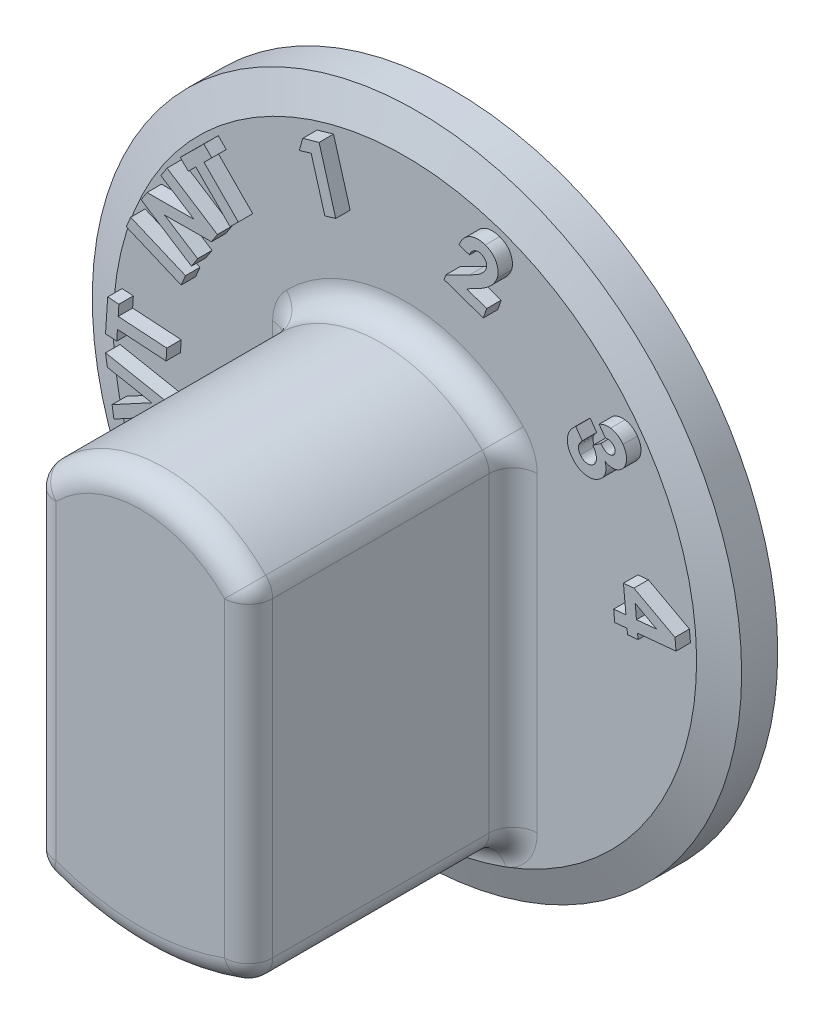
from build123d import *

# Parameters (mm, degrees)
SKETCH1_R           = 13.5
BOSS_EXTRUDE1_DEPTH = 2
CHAMFER1_SIZE       = 0.5
CHAMFER1_SIZE2      = 1.37373871
BOSS_EXTRUDE2_DEPTH = 11
FILLET1_R           = 1
HUECO_DEPTH         = 9.5
TEXTOS_DEPTH        = 0.6
SKETCH8_R           = 3.5
CUT_EXTRUDE1_DEPTH  = 0.6


with BuildPart() as part:
    # Sketch1 → Boss-Extrude1 (new body)
    with BuildSketch(Plane.XY):
        Circle(SKETCH1_R)
    extrude(amount=BOSS_EXTRUDE1_DEPTH)

    # Chamfer1
    chamfer1_edges = [part.edges().sort_by_distance(p)[0] for p in [
        (-13.5, 0, 2),
    ]]
    chamfer1_side = [part.faces().sort_by_distance(p)[0] for p in [
        (-13.5, 0, 1),
    ]]
    chamfer(chamfer1_edges, length=CHAMFER1_SIZE, length2=CHAMFER1_SIZE2, reference=chamfer1_side[0])

    # Sketch2 → Boss-Extrude2 (add)
    with BuildSketch(Plane.XY.offset(2)):
        with BuildLine():
            Line((-4.5, 3.437234545), (-4.5, -9.502166475))
            ThreePointArc((-4.5, -9.502166475), (-4.320254825, -10.074164746), (-3.845635956, -10.440535158))
            ThreePointArc((-3.845635956, -10.440535158), (0, -11.12626129), (3.845635956, -10.440535158))
            ThreePointArc((3.845635956, -10.440535158), (4.320254825, -10.074164746), (4.5, -9.502166475))
            Line((4.5, -9.502166475), (4.5, 3.437234545))
            ThreePointArc((4.5, 3.437234545), (4.425601213, 3.815734736), (4.213475212, 4.137915016))
            ThreePointArc((4.213475212, 4.137915016), (0, 5.905566361), (-4.213475212, 4.137915016))
            ThreePointArc((-4.213475212, 4.137915016), (-4.425601213, 3.815734736), (-4.5, 3.437234545))
        make_face()
    extrude(amount=BOSS_EXTRUDE2_DEPTH)

    # Fillet1
    fillet1_edges = [part.edges().sort_by_distance(p)[0] for p in [
        (4.425601213, 3.815734736, 2),
        (0, 5.905566361, 2),
        (-4.425601213, 3.815734736, 2),
        (-4.5, -3.032465965, 2),
        (-4.320254825, -10.074164746, 2),
        (0, -11.12626129, 2),
        (4.320254825, -10.074164746, 2),
        (4.5, -3.032465965, 2),
        (4.425601213, 3.815734736, 13),
        (0, 5.905566361, 13),
        (-4.425601213, 3.815734736, 13),
        (-4.5, -3.032465965, 13),
        (-4.320254825, -10.074164746, 13),
        (0, -11.12626129, 13),
        (4.320254825, -10.074164746, 13),
        (4.5, -3.032465965, 13),
    ]]
    fillet(fillet1_edges, radius=FILLET1_R - 0.0001)  # a hair under: the kernel refuses the full size

    # Sketch6 → Hueco (cut)
    with BuildSketch(Plane(origin=(0, 0, 0), x_dir=(-1, 0, 0), z_dir=(0, 0, -1))):
        with BuildLine():
            ThreePointArc((-1.941278917, 1.947802907), (-2.106622219, 1.767665927), (-2.255310951, 1.573554103))
            ThreePointArc((-2.255310951, 1.573554103), (-2.663028117, 1.5375), (-2.490393303, 1.166379525))
            ThreePointArc((-2.490393303, 1.166379525), (-2.584154707, 0.940555394), (-2.657486258, 0.707295405))
            ThreePointArc((-2.657486258, 0.707295405), (-3.028283841, 0.533968146), (-2.739129502, 0.244273558))
            ThreePointArc((-2.739129502, 0.244273558), (-2.75, 0), (-2.739129502, -0.244273558))
            ThreePointArc((-2.739129502, -0.244273558), (-3.028283841, -0.533968146), (-2.657486258, -0.707295405))
            ThreePointArc((-2.657486258, -0.707295405), (-2.584154707, -0.940555394), (-2.490393303, -1.166379525))
            ThreePointArc((-2.490393303, -1.166379525), (-2.663028117, -1.5375), (-2.255310951, -1.573554103))
            ThreePointArc((-2.255310951, -1.573554103), (-2.106622219, -1.767665927), (-1.941278917, -1.947802907))
            ThreePointArc((-1.941278917, -1.947802907), (-1.9765719, -2.355586663), (-1.581111858, -2.250018954))
            ThreePointArc((-1.581111858, -2.250018954), (-1.375, -2.38156986), (-1.158017644, -2.494292512))
            ThreePointArc((-1.158017644, -2.494292512), (-1.051711941, -2.889554809), (-0.71620734, -2.655098312))
            ThreePointArc((-0.71620734, -2.655098312), (-0.477532489, -2.708221321), (-0.235082352, -2.739933628))
            ThreePointArc((-0.235082352, -2.739933628), (0, -3.075), (0.235082352, -2.739933628))
            ThreePointArc((0.235082352, -2.739933628), (0.477532489, -2.708221321), (0.71620734, -2.655098312))
            ThreePointArc((0.71620734, -2.655098312), (1.051711941, -2.889554809), (1.158017644, -2.494292512))
            ThreePointArc((1.158017644, -2.494292512), (1.375, -2.38156986), (1.581111858, -2.250018954))
            ThreePointArc((1.581111858, -2.250018954), (1.9765719, -2.355586663), (1.941278917, -1.947802907))
            ThreePointArc((1.941278917, -1.947802907), (2.106622219, -1.767665927), (2.255310951, -1.573554103))
            ThreePointArc((2.255310951, -1.573554103), (2.663028117, -1.5375), (2.490393303, -1.166379525))
            ThreePointArc((2.490393303, -1.166379525), (2.584154707, -0.940555394), (2.657486258, -0.707295405))
            ThreePointArc((2.657486258, -0.707295405), (3.028283841, -0.533968146), (2.739129502, -0.244273558))
            ThreePointArc((2.739129502, -0.244273558), (2.75, 0), (2.739129502, 0.244273558))
            ThreePointArc((2.739129502, 0.244273558), (3.028283841, 0.533968146), (2.657486258, 0.707295405))
            ThreePointArc((2.657486258, 0.707295405), (2.584154707, 0.940555394), (2.490393303, 1.166379525))
            ThreePointArc((2.490393303, 1.166379525), (2.663028117, 1.5375), (2.255310951, 1.573554103))
            ThreePointArc((2.255310951, 1.573554103), (2.106622219, 1.767665927), (1.941278917, 1.947802907))
            ThreePointArc((1.941278917, 1.947802907), (1.9765719, 2.355586663), (1.581111858, 2.250018954))
            ThreePointArc((1.581111858, 2.250018954), (1.375, 2.38156986), (1.158017644, 2.494292512))
            ThreePointArc((1.158017644, 2.494292512), (1.051711941, 2.889554809), (0.71620734, 2.655098312))
            ThreePointArc((0.71620734, 2.655098312), (0.477532489, 2.708221321), (0.235082352, 2.739933628))
            ThreePointArc((0.235082352, 2.739933628), (0, 3.075), (-0.235082352, 2.739933628))
            ThreePointArc((-0.235082352, 2.739933628), (-0.477532489, 2.708221321), (-0.71620734, 2.655098312))
            ThreePointArc((-0.71620734, 2.655098312), (-1.051711941, 2.889554809), (-1.158017644, 2.494292512))
            ThreePointArc((-1.158017644, 2.494292512), (-1.375, 2.38156986), (-1.581111858, 2.250018954))
            ThreePointArc((-1.581111858, 2.250018954), (-1.9765719, 2.355586663), (-1.941278917, 1.947802907))
        make_face()
    extrude(amount=-HUECO_DEPTH, mode=Mode.SUBTRACT)

    # Sketch7 → Textos (add, symmetric)
    # profile 1 of 10: a face of its own
    with BuildSketch(Plane.XY.offset(2)):
        Polygon((11.826804085, 1.007222563), (11.872377001, 0.533965351), (10.271315303, 0.379718556), (10.292849758, 0.15836439), (9.855149437, 0.116297082), (9.833614982, 0.337651249), (9.323298476, 0.288572723), (9.278727162, 0.751313108), (9.789043668, 0.800391633), (9.684877001, 1.885628011), (10.122577322, 1.927695319), align=None)
        Polygon((10.226743989, 0.842458941), (11.060077322, 0.922587146), (10.172156649, 1.410367595), align=None, mode=Mode.SUBTRACT)
    # profile 2 of 10: a face of its own
    with BuildSketch(Plane.XY.offset(2)):
        with BuildLine():
            Line((8.935891774, 6.73477376), (8.672470299, 7.105366709))
            add(Edge.make_bspline(
                [(8.672470299, 7.105366709), (8.692680934, 7.115721089), (8.732297847, 7.136017759), (8.793357979, 7.160196491), (8.853492449, 7.180783426), (8.913526058, 7.195217605), (8.97301642, 7.204311224), (9.031971126, 7.208306677), (9.090491851, 7.207613867), (9.129061928, 7.202874467), (9.148231517, 7.200518952)],
                knots=[0, 0, 0, 0, 1.103396783, 2.162879835, 3.189462023, 4.191399139, 5.160146845, 6.111917816, 7.06161038, 8, 8, 8, 8], degree=3))
            add(Edge.make_bspline(
                [(9.148231517, 7.200518952), (9.174396224, 7.19570593), (9.22618194, 7.186179898), (9.300995459, 7.16278587), (9.372244831, 7.132648926), (9.439671569, 7.094972857), (9.502800201, 7.049544382), (9.562398814, 6.997491442), (9.618428578, 6.938349529), (9.651311996, 6.894056149), (9.668063248, 6.87149251)],
                knots=[0, 0, 0, 0, 1.008156502, 1.995363734, 2.965452835, 3.93760543, 4.917866365, 5.909448424, 6.935045135, 8, 8, 8, 8], degree=3))
            add(Edge.make_bspline(
                [(9.668063248, 6.87149251), (9.682165351, 6.850883554), (9.709939929, 6.810293503), (9.743808291, 6.746000365), (9.770893855, 6.680860544), (9.792673394, 6.61509693), (9.805570496, 6.547733413), (9.813597694, 6.479593711), (9.813942845, 6.410427641), (9.807338563, 6.34121289), (9.794741325, 6.273612647), (9.777708657, 6.208803224), (9.75386284, 6.148047709), (9.724148445, 6.091524492), (9.689577966, 6.038278025), (9.648599069, 5.9896914), (9.602472585, 5.944608738), (9.56787574, 5.918602219), (9.550374947, 5.905446837)],
                knots=[0, 0, 0, 0, 1.10669362, 2.179671362, 3.214931463, 4.233326567, 5.245243608, 6.250777107, 7.272395839, 8.305881078, 9.329536189, 10.319027588, 11.273075315, 12.216755946, 13.146866148, 14.08238128, 15.029973707, 16, 16, 16, 16], degree=3))
            add(Edge.make_bspline(
                [(9.550374947, 5.905446837), (9.527760118, 5.890504619), (9.483012973, 5.860938991), (9.408837539, 5.830012925), (9.33137591, 5.810352207), (9.250922094, 5.801713941), (9.168390339, 5.805350114), (9.08491869, 5.821407813), (9.000702842, 5.848799558), (8.946921297, 5.875990313), (8.919365331, 5.889921997)],
                knots=[0, 0, 0, 0, 0.973368935, 1.925969927, 2.874206825, 3.840509872, 4.826323472, 5.834583233, 6.890508817, 8, 8, 8, 8], degree=3))
            add(Edge.make_bspline(
                [(8.919365331, 5.889921997), (8.925334348, 5.871475244), (8.937103458, 5.835103778), (8.949434441, 5.779955914), (8.957685673, 5.725567603), (8.961019996, 5.671959901), (8.96072765, 5.619040474), (8.955679972, 5.566750795), (8.946057883, 5.515207417), (8.932592636, 5.464609058), (8.915098754, 5.415487213), (8.893483262, 5.368237505), (8.86795724, 5.323193859), (8.838486573, 5.28028335), (8.805838279, 5.239107841), (8.768029022, 5.201206662), (8.727824949, 5.164155775), (8.698066043, 5.142288341), (8.682987126, 5.131208055)],
                knots=[0, 0, 0, 0, 1.086078135, 2.14142045, 3.16283628, 4.166008758, 5.148375047, 6.125828803, 7.105697244, 8.083777602, 9.057328436, 10.02438465, 10.99216464, 11.954866766, 12.939635693, 13.932018698, 14.95214838, 16, 16, 16, 16], degree=3))
            add(Edge.make_bspline(
                [(8.682987126, 5.131208055), (8.660253424, 5.115851999), (8.615601575, 5.085690775), (8.544091682, 5.049480755), (8.470901996, 5.02135569), (8.395717125, 5.001150415), (8.318837995, 4.9889677), (8.23991286, 4.98567568), (8.159242288, 4.990271739), (8.077412459, 5.002812588), (7.996484458, 5.022992553), (7.918245016, 5.051425948), (7.843275505, 5.086765587), (7.772340792, 5.13102762), (7.70450837, 5.182187474), (7.64029815, 5.241032294), (7.579649319, 5.307626874), (7.543252083, 5.356571825), (7.524633761, 5.381608696)],
                knots=[0, 0, 0, 0, 0.994162639, 1.952660351, 2.899364803, 3.833381905, 4.771002391, 5.716408938, 6.692657941, 7.697017763, 8.714592818, 9.712362041, 10.711617939, 11.714681377, 12.739059548, 13.788953909, 14.868980899, 16, 16, 16, 16], degree=3))
            add(Edge.make_bspline(
                [(7.524633761, 5.381608696), (7.507958194, 5.406017379), (7.475345544, 5.453753799), (7.435487376, 5.529066345), (7.402457044, 5.604240514), (7.377831282, 5.680236291), (7.360911187, 5.7566884), (7.353180488, 5.833968635), (7.352487841, 5.911631846), (7.360088916, 5.98950715), (7.375600987, 6.066333331), (7.398647103, 6.141438817), (7.429871226, 6.213992136), (7.469514509, 6.283663493), (7.515546647, 6.351767201), (7.570115281, 6.416940777), (7.632283829, 6.479774545), (7.678383182, 6.518294163), (7.701917415, 6.537958856)],
                knots=[0, 0, 0, 0, 1.084912083, 2.121778519, 3.124063135, 4.09736983, 5.050993605, 5.994153796, 6.944480523, 7.899227032, 8.862342566, 9.818407093, 10.779627863, 11.756846648, 12.758455971, 13.794651513, 14.87414508, 16, 16, 16, 16], degree=3))
            Line((7.701917415, 6.537958856), (7.97335171, 6.156348279))
            add(Edge.make_bspline(
                [(7.97335171, 6.156348279), (7.951938705, 6.134250159), (7.911260432, 6.092270373), (7.86400429, 6.022685799), (7.831201189, 5.952838536), (7.814629109, 5.882127633), (7.814019141, 5.81209704), (7.826077495, 5.743155968), (7.852786091, 5.675479544), (7.879453576, 5.633931624), (7.893223505, 5.612478087)],
                knots=[0, 0, 0, 0, 1.21344472, 2.305180295, 3.305378785, 4.245813004, 5.149184569, 6.053229573, 6.994772523, 8, 8, 8, 8], degree=3))
            add(Edge.make_bspline(
                [(7.893223505, 5.612478087), (7.901175985, 5.60160554), (7.916807573, 5.580234196), (7.943805777, 5.551880344), (7.971511647, 5.525811608), (8.002210967, 5.504590583), (8.033377527, 5.48509644), (8.067057074, 5.470183898), (8.102023691, 5.458052117), (8.150318662, 5.446874026), (8.21133014, 5.441925407), (8.283335075, 5.449600608), (8.352201929, 5.473182205), (8.393147413, 5.499088429), (8.414056838, 5.512317831)],
                knots=[0, 0, 0, 0, 0.818353892, 1.608576324, 2.377577747, 3.127028539, 3.873999524, 4.610058134, 5.36136341, 6.122347517, 7.619769825, 9.060498181, 10.498899403, 12, 12, 12, 12], degree=3))
            add(Edge.make_bspline(
                [(8.414056838, 5.512317831), (8.425101478, 5.520763801), (8.446841741, 5.537388844), (8.475746722, 5.566094951), (8.499726698, 5.598136419), (8.520637525, 5.632331313), (8.537164364, 5.669733065), (8.549616486, 5.709914897), (8.558088493, 5.752722145), (8.562559822, 5.797987884), (8.562771616, 5.845348343), (8.556848424, 5.894295333), (8.546470211, 5.94450658), (8.530005011, 5.995791708), (8.508846301, 6.048469686), (8.482781641, 6.102617816), (8.451165284, 6.157860971), (8.426660259, 6.193901608), (8.414056838, 6.212438023)],
                knots=[0, 0, 0, 0, 0.853699976, 1.680422637, 2.492706139, 3.307058826, 4.13803267, 4.997626229, 5.886634055, 6.814260636, 7.788562636, 8.789752487, 9.837703632, 10.934068485, 12.093882313, 13.323211373, 14.62327442, 16, 16, 16, 16], degree=3))
            Line((8.414056838, 6.212438023), (8.744585684, 6.447313824))
            add(Edge.make_bspline(
                [(8.744585684, 6.447313824), (8.761979254, 6.427002478), (8.794505662, 6.389019755), (8.844480074, 6.339935703), (8.889576212, 6.300086666), (8.932688767, 6.270868428), (8.974662061, 6.251024023), (9.015684519, 6.236463248), (9.057451641, 6.229155668), (9.098893261, 6.226856489), (9.13931187, 6.231091109), (9.177703221, 6.239846331), (9.213627645, 6.254567242), (9.235068704, 6.2685057), (9.245887767, 6.275538984)],
                knots=[0, 0, 0, 0, 1.634258419, 3.056103969, 4.279447457, 5.309893621, 6.227497039, 7.111915362, 7.962772713, 8.810932038, 9.641716835, 10.438904402, 11.212278056, 12, 12, 12, 12], degree=3))
            add(Edge.make_bspline(
                [(9.245887767, 6.275538984), (9.258756333, 6.285520651), (9.283807575, 6.304951965), (9.312209169, 6.342713622), (9.332254022, 6.384603416), (9.343017527, 6.430483804), (9.34544575, 6.478735581), (9.336274242, 6.527335784), (9.31804882, 6.575829677), (9.298605605, 6.605238896), (9.288455876, 6.620591068)],
                knots=[0, 0, 0, 0, 0.999617133, 1.94595494, 2.879914432, 3.842875369, 4.831156737, 5.833943911, 6.869277492, 8, 8, 8, 8], degree=3))
            add(Edge.make_bspline(
                [(9.288455876, 6.620591068), (9.278369168, 6.633672396), (9.258285685, 6.659718419), (9.220597468, 6.691658628), (9.178477679, 6.717750422), (9.131984073, 6.736402986), (9.083278878, 6.74852689), (9.033706738, 6.752765569), (8.984094066, 6.748125399), (8.952146045, 6.73927606), (8.935891774, 6.73477376)],
                knots=[0, 0, 0, 0, 0.997178702, 1.985466464, 2.969511962, 3.98433942, 5.003531315, 5.996762607, 6.980808105, 8, 8, 8, 8], degree=3))
        make_face()
    # profile 3 of 10: a face of its own
    with BuildSketch(Plane.XY.offset(2)):
        with BuildLine():
            Line((3.283888631, 10.504603799), (2.848191516, 10.656346587))
            add(Edge.make_bspline(
                [(2.848191516, 10.656346587), (2.861126652, 10.68642262), (2.886398951, 10.745184312), (2.930610109, 10.828279382), (2.979631533, 10.904077345), (3.033364928, 10.972548869), (3.091639779, 11.033769337), (3.155150292, 11.086816066), (3.222684551, 11.133472889), (3.294577219, 11.172371396), (3.369694369, 11.203267737), (3.446608135, 11.22673146), (3.525279048, 11.240951062), (3.605238615, 11.248297817), (3.686854587, 11.246708412), (3.769706618, 11.236123671), (3.854396601, 11.219088766), (3.910045577, 11.20095462), (3.938435907, 11.191703158)],
                knots=[0, 0, 0, 0, 1.156015498, 2.258589949, 3.319973446, 4.340274833, 5.328591897, 6.299430632, 7.25779956, 8.223396109, 9.180385618, 10.12238191, 11.057934721, 11.999044881, 12.954380097, 13.934360659, 14.946176778, 16, 16, 16, 16], degree=3))
            add(Edge.make_bspline(
                [(3.938435907, 11.191703158), (3.972838008, 11.178469675), (4.039834013, 11.152698269), (4.132456363, 11.101645477), (4.214332002, 11.041034112), (4.285933216, 10.97175104), (4.346198429, 10.893985635), (4.396232713, 10.809373171), (4.43248206, 10.716501875), (4.457586668, 10.618955293), (4.471437745, 10.519732), (4.471616621, 10.422355258), (4.461199297, 10.327980347), (4.442855332, 10.268348082), (4.433728375, 10.238678318)],
                knots=[0, 0, 0, 0, 1.108947221, 2.159607475, 3.172980879, 4.168291471, 5.14964376, 6.127281529, 7.117629597, 8.140507734, 9.154940234, 10.125080252, 11.067142168, 12, 12, 12, 12], degree=3))
            add(Edge.make_bspline(
                [(4.433728375, 10.238678318), (4.427072539, 10.221241043), (4.413596981, 10.185937137), (4.389589794, 10.13369474), (4.360851215, 10.08215258), (4.328074614, 10.030935011), (4.291590182, 9.97985033), (4.250742011, 9.929221791), (4.206237679, 9.878654369), (4.157286999, 9.82816068), (4.102754064, 9.77748316), (4.040795234, 9.727207575), (3.972257437, 9.675582992), (3.896475916, 9.623600457), (3.813741012, 9.571078068), (3.723920408, 9.517907985), (3.626695326, 9.464497776), (3.559069793, 9.429409291), (3.524273247, 9.4113546)],
                knots=[0, 0, 0, 0, 0.711212675, 1.439937426, 2.188877176, 2.958368846, 3.756367895, 4.580049792, 5.436495162, 6.322830741, 7.25924049, 8.271785174, 9.362240093, 10.528716824, 11.772980213, 13.096483964, 14.506003179, 16, 16, 16, 16], degree=3))
            Line((3.524273247, 9.4113546), (3.164697926, 9.225557324))
            Line((3.164697926, 9.225557324), (4.001036067, 8.934090978))
            Line((4.001036067, 8.934090978), (3.856805298, 8.520429119))
            Line((3.856805298, 8.520429119), (2.230202734, 9.086835369))
            Line((2.230202734, 9.086835369), (2.304822125, 9.300677517))
            Line((2.304822125, 9.300677517), (3.289397445, 9.788457965))
            add(Edge.make_bspline(
                [(3.289397445, 9.788457965), (3.317986023, 9.802728109), (3.373231385, 9.830304133), (3.452458271, 9.871594125), (3.524652582, 9.91250009), (3.590675965, 9.951183081), (3.64986981, 9.988679939), (3.702322911, 10.024939948), (3.748347531, 10.059591873), (3.799541298, 10.103650386), (3.853443524, 10.157926696), (3.90718247, 10.223849255), (3.949671756, 10.289552393), (3.968460114, 10.335679298), (3.977498407, 10.357869023)],
                knots=[0, 0, 0, 0, 1.258257201, 2.431491209, 3.517584003, 4.525483697, 5.444602701, 6.276116506, 7.036053709, 7.711994395, 8.934507047, 10.042267108, 11.058216548, 12, 12, 12, 12], degree=3))
            add(Edge.make_bspline(
                [(3.977498407, 10.357869023), (3.98404471, 10.380052722), (3.996711223, 10.422976201), (4.000977718, 10.489447323), (3.990492887, 10.553710971), (3.967323356, 10.614738371), (3.932808319, 10.670696897), (3.886915055, 10.718669955), (3.829854504, 10.757059765), (3.78658604, 10.774176531), (3.764157061, 10.783049312)],
                knots=[0, 0, 0, 0, 1.039019912, 2.010410838, 2.969247526, 3.949177999, 4.93146899, 5.909553148, 6.91637964, 8, 8, 8, 8], degree=3))
            add(Edge.make_bspline(
                [(3.764157061, 10.783049312), (3.740657516, 10.790040256), (3.694657485, 10.803724931), (3.622713956, 10.804446651), (3.552535635, 10.790794148), (3.496884691, 10.766300325), (3.454606936, 10.739840139), (3.424168967, 10.716436688), (3.395660405, 10.689408157), (3.369360702, 10.658906188), (3.344782714, 10.625218829), (3.321979358, 10.588321784), (3.301610599, 10.547842856), (3.289875224, 10.519210226), (3.283888631, 10.504603799)],
                knots=[0, 0, 0, 0, 1.419430687, 2.778515855, 4.133748901, 5.550888227, 6.283382005, 7.030770308, 7.779103277, 8.563391224, 9.36900811, 10.201309774, 11.082430171, 12, 12, 12, 12], degree=3))
        make_face()
    # profile 4 of 10: a face of its own
    with BuildSketch(Plane.XY.offset(2)):
        Polygon((-3.650720467, 11.234584498), (-2.968629121, 11.431399402), (-2.277523351, 9.037068472), (-2.729746909, 8.906359338), (-3.297154762, 10.872505171), (-3.790444025, 10.730277607), align=None)
    # profile 5 of 10: a face of its own
    with BuildSketch(Plane.XY.offset(2)):
        Polygon((-8.738935277, 8.006295801), (-7.758867168, 8.976848686), (-7.429339925, 8.643815833), (-7.752356752, 8.323803814), (-6.327076303, 6.884000128), (-6.66962438, 6.54495766), (-8.094904829, 7.984761346), (-8.409408034, 7.673262949), align=None)
    # profile 6 of 10: a face of its own
    with BuildSketch(Plane.XY.offset(2)):
        Polygon((-10.368252114, 5.666913574), (-10.123360287, 6.048524151), (-8.167731281, 6.061044183), (-9.546437211, 6.946961651), (-9.290026954, 7.345599472), (-7.195175191, 5.999946427), (-7.441569422, 5.616833446), (-9.391689614, 5.602310209), (-8.017490896, 4.71989835), (-8.273400352, 4.32126053), align=None)
    # profile 7 of 10: a face of its own
    with BuildSketch(Plane.XY.offset(2)):
        Polygon((-10.983993567, 4.387387191), (-10.802202701, 4.818076294), (-8.523056067, 3.855035429), (-8.704846932, 3.424346326), align=None)
    # profile 8 of 10: a face of its own
    with BuildSketch(Plane.XY.offset(2)):
        Polygon((-11.847354545, 0.0985755), (-11.758211916, 1.472774218), (-11.291465121, 1.442726141), (-11.321012397, 0.989500981), (-9.301280827, 0.858791846), (-9.332330506, 0.379024218), (-11.352062077, 0.509733352), (-11.38060775, 0.068527423), align=None)
    # profile 9 of 10: a face of its own
    with BuildSketch(Plane.XY.offset(2)):
        Polygon((-11.500739024, -2.797000474), (-11.576360018, -2.314728839), (-9.923214986, -1.420798551), (-11.772173319, -1.067232846), (-11.847293511, -0.584961211), (-9.24513005, -1.086263294), (-9.174016268, -1.538486852), align=None)
    # profile 10 of 10: a face of its own
    with BuildSketch(Plane.XY.offset(2)):
        with BuildLine():
            Line((-10.714130604, -4.963281673), (-10.896923072, -4.498538083))
            add(Edge.make_bspline(
                [(-10.896923072, -4.498538083), (-10.908595464, -4.468045874), (-10.931083499, -4.409299573), (-10.961063009, -4.323608943), (-10.987064957, -4.243797739), (-11.007500309, -4.169571552), (-11.023256854, -4.100905151), (-11.034560031, -4.038095182), (-11.040616394, -3.980855786), (-11.042579497, -3.928582111), (-11.03906633, -3.879910758), (-11.033388243, -3.832786954), (-11.02323743, -3.786932741), (-11.009756687, -3.74219519), (-10.992548185, -3.69886686), (-10.971951909, -3.656679288), (-10.947798299, -3.615530297), (-10.920284925, -3.575450882), (-10.889368547, -3.537065841), (-10.855205039, -3.50071451), (-10.81738395, -3.467236076), (-10.776776907, -3.435807685), (-10.733595473, -3.405887637), (-10.686823807, -3.378878299), (-10.636789793, -3.354509539), (-10.602026414, -3.340013264), (-10.584423072, -3.332672699)],
                knots=[0, 0, 0, 0, 1.690828889, 3.257551554, 4.701148322, 6.037187787, 7.243117176, 8.348914639, 9.339932821, 10.222142613, 11.05371824, 11.864403872, 12.678355908, 13.482422454, 14.281921198, 15.090021199, 15.911468515, 16.750782809, 17.605451686, 18.461649605, 19.331101212, 20.218253395, 21.119904468, 22.049634283, 23.012381548, 24, 24, 24, 24], degree=3))
            add(Edge.make_bspline(
                [(-10.584423072, -3.332672699), (-10.564680436, -3.325120429), (-10.525861198, -3.310270672), (-10.466652834, -3.294805637), (-10.408707541, -3.28277699), (-10.351721998, -3.2763572), (-10.295740936, -3.27466002), (-10.240825883, -3.278467414), (-10.186678256, -3.285948123), (-10.134003656, -3.300176194), (-10.082449725, -3.31709485), (-10.033277412, -3.339806518), (-9.985303842, -3.364990033), (-9.939948353, -3.395395907), (-9.895865628, -3.429080396), (-9.854144607, -3.467072866), (-9.814017823, -3.508988338), (-9.789592045, -3.539475603), (-9.777131405, -3.555028468)],
                knots=[0, 0, 0, 0, 1.119302908, 2.200845211, 3.238293541, 4.253285024, 5.23556096, 6.201772428, 7.167578861, 8.126636722, 9.088952815, 10.039239995, 10.993061535, 11.957286705, 12.928667708, 13.930740203, 14.944381578, 16, 16, 16, 16], degree=3))
            add(Edge.make_bspline(
                [(-9.777131405, -3.555028468), (-9.769649203, -3.565453983), (-9.753383283, -3.588118511), (-9.730159796, -3.6269693), (-9.705157068, -3.672595693), (-9.678691849, -3.725256655), (-9.650886088, -3.784812305), (-9.62099546, -3.851049545), (-9.590961911, -3.924704796), (-9.57012602, -3.976033124), (-9.559282848, -4.002744814)],
                knots=[0, 0, 0, 0, 0.616935112, 1.341184906, 2.174787505, 3.119073227, 4.174954117, 5.335746697, 6.613500353, 8, 8, 8, 8], degree=3))
            Line((-9.559282848, -4.002744814), (-8.584222752, -3.618630231))
            Line((-8.584222752, -3.618630231), (-8.411947111, -4.056831352))
            Line((-8.411947111, -4.056831352), (-10.714130604, -4.963281673))
        make_face()
        with BuildLine():
            Line((-9.986466341, -4.171014045), (-10.041554482, -4.031791288))
            add(Edge.make_bspline(
                [(-10.041554482, -4.031791288), (-10.051871328, -4.006665996), (-10.070811639, -3.960539411), (-10.099538967, -3.898507387), (-10.126499183, -3.850049196), (-10.152956366, -3.813983026), (-10.179828918, -3.787426269), (-10.208261121, -3.767393769), (-10.238635026, -3.751138974), (-10.271898045, -3.741552774), (-10.306620825, -3.736331075), (-10.342805852, -3.736936491), (-10.380197689, -3.743443935), (-10.404580895, -3.752289618), (-10.417155444, -3.756851384)],
                knots=[0, 0, 0, 0, 1.82984891, 3.359351263, 4.603736682, 5.559753187, 6.363046453, 7.137066683, 7.896651894, 8.672304735, 9.456473023, 10.255107189, 11.100149467, 12, 12, 12, 12], degree=3))
            add(Edge.make_bspline(
                [(-10.417155444, -3.756851384), (-10.427807378, -3.761248231), (-10.448369383, -3.769735701), (-10.476297924, -3.786722013), (-10.500850539, -3.805679768), (-10.522454146, -3.826917818), (-10.539797818, -3.850904993), (-10.553651008, -3.877241019), (-10.564263591, -3.905675333), (-10.568334702, -3.925883413), (-10.570400636, -3.936138243)],
                knots=[0, 0, 0, 0, 1.114370995, 2.151130525, 3.153422065, 4.113508162, 5.073730316, 6.006486225, 6.988367721, 8, 8, 8, 8], degree=3))
            add(Edge.make_bspline(
                [(-10.570400636, -3.936138243), (-10.571439888, -3.944472627), (-10.573658189, -3.962262511), (-10.572738537, -3.990833474), (-10.569067718, -4.022780379), (-10.562527926, -4.058083927), (-10.552727951, -4.096962403), (-10.540296671, -4.139262655), (-10.524631514, -4.184995953), (-10.512581508, -4.216292907), (-10.506298072, -4.232612602)],
                knots=[0, 0, 0, 0, 0.657259141, 1.402930778, 2.232038404, 3.176153203, 4.213517427, 5.372403576, 6.629848365, 8, 8, 8, 8], degree=3))
            Line((-10.506298072, -4.232612602), (-10.457720348, -4.356310519))
            Line((-10.457720348, -4.356310519), (-9.986466341, -4.171014045))
        make_face(mode=Mode.SUBTRACT)
    extrude(amount=TEXTOS_DEPTH, both=True)

    # Sketch8 → Cut-Extrude1 (cut)
    with BuildSketch(Plane(origin=(0, 0, 0), x_dir=(-1, 0, 0), z_dir=(0, 0, -1))):
        Circle(SKETCH8_R)
    extrude(amount=-CUT_EXTRUDE1_DEPTH, mode=Mode.SUBTRACT)


solid = part.part
